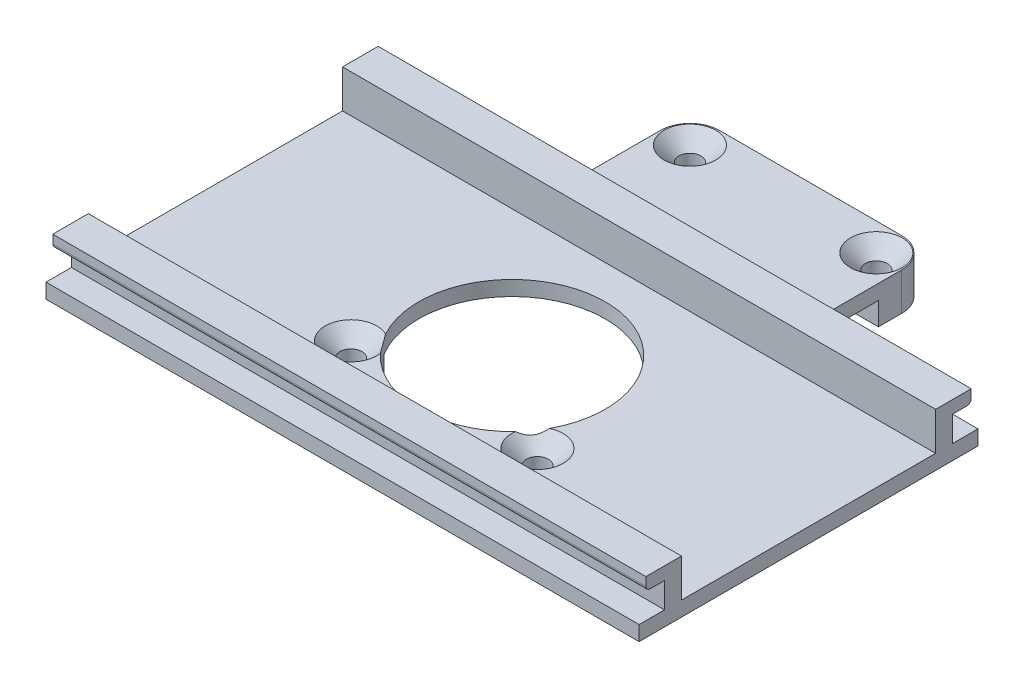
from build123d import *

# Parameters (mm, degrees)
BOSS_EXTRUDE1_DEPTH = 1.75
SKETCH2_W           = 70
SKETCH2_H           = 2
BOSS_EXTRUDE2_DEPTH = 3
SKETCH3_W           = 70
SKETCH3_H           = 4.2
BOSS_EXTRUDE3_DEPTH = 1.5
SKETCH4_W           = 6.25
SKETCH4_H           = 6.25
BOSS_EXTRUDE4_DEPTH = 2.7
SKETCH6_R           = 1.3
CUT_EXTRUDE2_DEPTH  = 51.474399452
FILLET3_R           = 3.5
SKETCH7_R           = 11
CUT_EXTRUDE3_DEPTH  = 50.877976102
CHAMFER1_SIZE       = 1.75
FILLET4_R           = 0.5


with BuildPart() as part:
    # Sketch1 → Boss-Extrude1 (new body)
    with BuildSketch(Plane(origin=(0, 0, 0), x_dir=(1, 0, 0), z_dir=(0, 1, 0))):
        Polygon((35, 20), (35, -20), (-35, -20), (-35, 20), (-14.25, 20), (-14.25, 35.25), (0, 35.25), (14.25, 35.25), (14.25, 20), align=None)
    extrude(amount=BOSS_EXTRUDE1_DEPTH)

    # Sketch2 → Boss-Extrude2 (add)
    with BuildSketch(Plane(origin=(0, 1.75, 0), x_dir=(1, 0, 0), z_dir=(0, 1, 0))):
        with Locations((0, 16)):
            Rectangle(SKETCH2_W, SKETCH2_H)
        with Locations((0, -16)):
            Rectangle(SKETCH2_W, SKETCH2_H)
    extrude(amount=BOSS_EXTRUDE2_DEPTH)

    # Sketch3 → Boss-Extrude3 (add)
    with BuildSketch(Plane(origin=(0, 4.75, 0), x_dir=(1, 0, 0), z_dir=(0, 1, 0))):
        with Locations((0, 17.1)):
            Rectangle(SKETCH3_W, SKETCH3_H)
        with Locations((0, -17.1)):
            Rectangle(SKETCH3_W, SKETCH3_H)
    extrude(amount=BOSS_EXTRUDE3_DEPTH)

    # Sketch4 → Boss-Extrude4 (add)
    with BuildSketch(Plane.XZ):
        Polygon((-11, -35.25), (-8, -35.25), (-8, -32), (-8, -29), (-11, -29), (-14.25, -29), (-14.25, -32), (-14.25, -35.25), align=None)
        with Locations((11.125, -32.125)):
            Rectangle(SKETCH4_W, SKETCH4_H)
        Polygon((14.25, 8), (14.25, 5), (8, 5), (8, 8.25), (8, 11.25), (14.25, 11.25), align=None)
        Polygon((-14.25, 11.25), (-8, 11.25), (-8, 8.25), (-8, 5), (-11, 5), (-14.25, 5), (-14.25, 8), align=None)
    extrude(amount=BOSS_EXTRUDE4_DEPTH)

    # Sketch6 → Cut-Extrude2 (cut, through all)
    with BuildSketch(Plane.XZ.offset(2.7)):
        with Locations(Location((-11, -32, 0), (0, 0, 270))):
            Circle(SKETCH6_R)
        with Locations(Location((11, -32, 0), (0, 0, 270))):
            Circle(SKETCH6_R)
        with Locations(Location((-11, 8, 0), (0, 0, 270))):
            Circle(SKETCH6_R)
        with Locations(Location((11, 8, 0), (0, 0, 270))):
            Circle(SKETCH6_R)
    extrude(amount=-CUT_EXTRUDE2_DEPTH, mode=Mode.SUBTRACT)

    # Fillet3
    fillet3_edges = [part.edges().sort_by_distance(p)[0] for p in [
        (-8, -1.35, 5),
        (-14.25, -1.35, 11.25),
        (8, -1.35, 5),
        (14.25, -1.35, 11.25),
        (-14.25, -0.475, -35.25),
        (14.25, -0.475, -35.25),
        (8, -1.35, -29),
        (-8, -1.35, -29),
    ]]
    fillet(fillet3_edges, radius=FILLET3_R)

    # Sketch7 → Cut-Extrude3 (cut, through all)
    with BuildSketch(Plane(origin=(0, 1.75, 0), x_dir=(1, 0, 0), z_dir=(0, 1, 0))):
        with Locations(Location((0, 0, 0), (0, 0, 270))):
            Circle(SKETCH7_R)
    extrude(amount=-CUT_EXTRUDE3_DEPTH, mode=Mode.SUBTRACT)

    # Chamfer1
    # the kernel refuses this chamfer: 1.75 mm, written as the material it takes off along each edge
    with BuildSketch(Plane(origin=(11, 1.75, -32), x_dir=(0, 0, -1), z_dir=(-1, 0, 0))) as chamfer1_piece_1:
        Polygon((1.3 + CHAMFER1_SIZE, 0), (1.3, CHAMFER1_SIZE), (1.3, 0), align=None)
    revolve(axis=Axis((11, 1.75, -32), (0, -1, 0)), mode=Mode.SUBTRACT)
    with BuildSketch(Plane(origin=(-11, 1.75, 8), x_dir=(0, 0, -1), z_dir=(-1, 0, 0))) as chamfer1_piece_2:
        Polygon((1.3 + CHAMFER1_SIZE, 0), (1.3, CHAMFER1_SIZE), (1.3, 0), align=None)
    revolve(axis=Axis((-11, 1.75, 8), (0, -1, 0)), mode=Mode.SUBTRACT)
    with BuildSketch(Plane(origin=(11, 1.75, 8), x_dir=(0, 0, -1), z_dir=(-1, 0, 0))) as chamfer1_piece_3:
        Polygon((1.3 + CHAMFER1_SIZE, 0), (1.3, CHAMFER1_SIZE), (1.3, 0), align=None)
    revolve(axis=Axis((11, 1.75, 8), (0, -1, 0)), mode=Mode.SUBTRACT)
    with BuildSketch(Plane(origin=(-11, 1.75, -32), x_dir=(0, 0, -1), z_dir=(-1, 0, 0))) as chamfer1_piece_4:
        Polygon((1.3 + CHAMFER1_SIZE, 0), (1.3, CHAMFER1_SIZE), (1.3, 0), align=None)
    revolve(axis=Axis((-11, 1.75, -32), (0, -1, 0)), mode=Mode.SUBTRACT)

    # Fillet4
    fillet4_edges = [part.edges().sort_by_distance(p)[0] for p in [
        (0, 4.75, -19.2),
        (0, 4.75, 19.2),
    ]]
    fillet(fillet4_edges, radius=FILLET4_R)


solid = part.part
